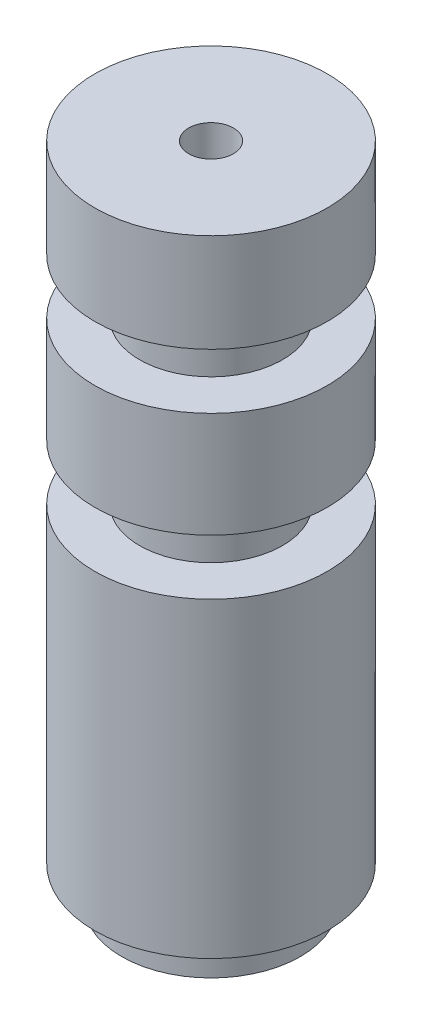
from build123d import *

# Parameters (mm, degrees)
SCHIZZO1_R                     = 6.5
ESTRUSIONE_ESTRUSIONE1_DEPTH   = 35
SCHIZZO6_R                     = 1.25
TAGLIO_ESTRUSIONE4_DEPTH       = 37.187014245
TAGLIO_ESTRUSIONE5_START       = 17.4
TAGLIO_ESTRUSIONE5_OUTLINE_R   = 6.5
TAGLIO_ESTRUSIONE5_OUTLINE_R_2 = 4
TAGLIO_ESTRUSIONE5_DEPTH       = 3.1
RIPETIZIONE_A_L1_COUNT         = 2
RIPETIZIONE_A_L1_PITCH         = 9
SCHIZZO8_R                     = 5
ESTRUSIONE_ESTRUSIONE2_DEPTH   = 2
SCHIZZO9_R                     = 1.25
TAGLIO_ESTRUSIONE6_DEPTH       = 39.124795081


# Read off the part's stored shape, not the designer's step: Taglio-Estrusione5
with BuildPart() as part:
    # Schizzo1 → Estrusione-Estrusione1 (new body)
    with BuildSketch(Plane(origin=(0, 0, 0), x_dir=(1, 0, 0), z_dir=(0, 1, 0))):
        with Locations(Location((0, 0, 0), (0, 0, 270))):
            Circle(SCHIZZO1_R)
    extrude(amount=ESTRUSIONE_ESTRUSIONE1_DEPTH)

    # Schizzo6 → Taglio-Estrusione4 (cut, through all)
    with BuildSketch(Plane.XZ):
        with Locations(Location((0, 0, 0), (0, 0, 270))):
            Circle(SCHIZZO6_R)
    extrude(amount=-TAGLIO_ESTRUSIONE4_DEPTH, mode=Mode.SUBTRACT)

    # Taglio-Estrusione5 outline → Taglio-Estrusione5 (cut)
    with BuildSketch(Plane(origin=(0, 0, 0), x_dir=(1, 0, 0), z_dir=(0, 1, 0)).offset(TAGLIO_ESTRUSIONE5_START)):
        Circle(TAGLIO_ESTRUSIONE5_OUTLINE_R)
        Circle(TAGLIO_ESTRUSIONE5_OUTLINE_R_2, mode=Mode.SUBTRACT)
    taglio_estrusione5 = extrude(amount=TAGLIO_ESTRUSIONE5_DEPTH, mode=Mode.SUBTRACT)

    # Ripetizione a L1: Taglio-Estrusione5 ×2
    with Locations(*[(0, i * RIPETIZIONE_A_L1_PITCH, 0) for i in range(1, RIPETIZIONE_A_L1_COUNT)]):
        add(taglio_estrusione5, mode=Mode.SUBTRACT)

    # Schizzo8 → Estrusione-Estrusione2 (add)
    with BuildSketch(Plane.XZ):
        with Locations(Location((0, 0, 0), (0, 0, 90))):
            Circle(SCHIZZO8_R)
    extrude(amount=ESTRUSIONE_ESTRUSIONE2_DEPTH)

    # Schizzo9 → Taglio-Estrusione6 (cut, through all)
    with BuildSketch(Plane.XZ.offset(2)):
        with Locations(Location((0, 0, 0), (0, 0, 270))):
            Circle(SCHIZZO9_R)
    extrude(amount=-TAGLIO_ESTRUSIONE6_DEPTH, mode=Mode.SUBTRACT)


solid = part.part
